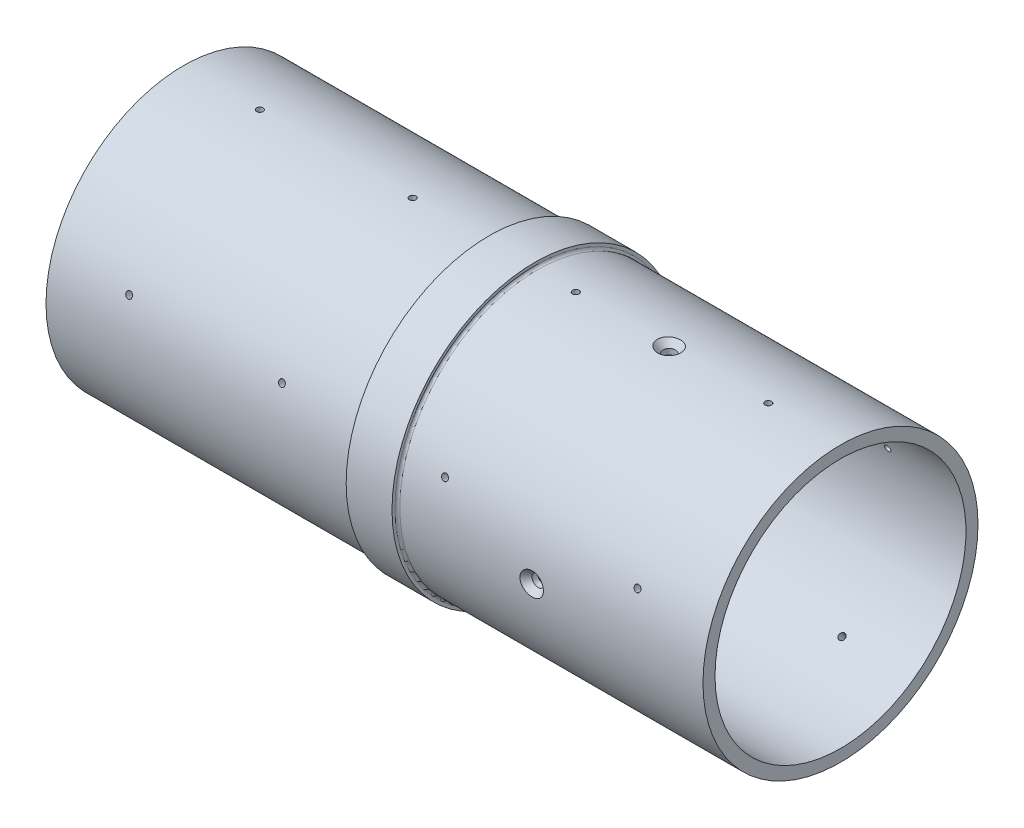
from build123d import *

# Parameters (mm, degrees)
F_6_32_TAPPED_HOLE2_REACH  = 304.768
F_6_32_TAPPED_HOLE2_BORE_R = 1.35255
F_6_32_TAPPED_HOLE1_REACH  = 304.768
F_6_32_TAPPED_HOLE1_BORE_R = 1.35255
CHAMFER1_SIZE              = 1
CIRPATTERN1_COUNT          = 4
CIRPATTERN3_COUNT          = 5


# Read off the part's stored shape, not the designer's step: CSK for #10 Flat Head Machine Screw1
with BuildPart() as part:
    # Sketch1 → Revolve1 (revolve)
    with BuildSketch(Plane(origin=(0, 0, 0), x_dir=(1, 0, 0), z_dir=(0, 1, 0)), mode=Mode.PRIVATE) as revolve1_sk:
        with BuildLine():
            Line((-95.7, 42.15), (-105.7, 52.15))
            Line((-105.7, 52.15), (-273.05, 52.15))
            Line((-273.05, 52.15), (-273.05, 57.15))
            Line((-273.05, 57.15), (-147.05, 57.15))
            ThreePointArc((-147.05, 57.15), (-146.342893219, 57.442893219), (-146.05, 58.15))
            Line((-146.05, 58.15), (-146.05, 59.4))
            Line((-146.05, 59.4), (-127, 59.4))
            Line((-127, 59.4), (-127, 58.15))
            ThreePointArc((-127, 58.15), (-126.707106781, 57.442893219), (-126, 57.15))
            Line((-126, 57.15), (0, 57.15))
            Line((0, 57.15), (0, 52.15))
            Line((0, 52.15), (-74.2, 52.15))
            Line((-74.2, 52.15), (-76.2, 52.15))
            Line((-76.2, 52.15), (-76.2, 50.15))
            Line((-76.2, 50.15), (-76.2, 42.15))
            Line((-76.2, 42.15), (-95.7, 42.15))
        make_face()
    revolve(revolve1_sk.sketch.rotate(Axis((-185.768615225, 0, 0), (1, 0, 0)), 180), axis=Axis((-185.768615225, 0, 0), (1, 0, 0)))

    # CSK for #10 Flat Head Machine Screw1 out → CSK for #10 Flat Head Machine Screw1 (revolve, cut)
    with BuildSketch(Plane(origin=(-71.2, 0, 0), x_dir=(1, 0, 0), z_dir=(0, 0, 1))):
        Polygon((4.889528756, 57.15003308), (0, 57.15003308), (0, 52.087452606), (2.5527, 52.087452606), (2.5527, 54.461819106), align=None)
    csk_for_10_flat_head_machine_screw1 = revolve(axis=Axis((-71.2, 0, 0), (0, 1, 0)), mode=Mode.SUBTRACT)

    # #6-32 Tapped Hole2 bore → #6-32 Tapped Hole2 (cut, up to next)
    with BuildSketch(Plane(origin=(0, 57.15, 0), x_dir=(1, 0, 0), z_dir=(0, 1, 0)), mode=Mode.PRIVATE) as f_6_32_tapped_hole2_sk1:
        with Locations((-30, 0)):
            Circle(F_6_32_TAPPED_HOLE2_BORE_R)
    f_6_32_tapped_hole2_tool1 = extrude(f_6_32_tapped_hole2_sk1.sketch, amount=-F_6_32_TAPPED_HOLE2_REACH, mode=Mode.PRIVATE) & part.part
    # #6-32 Tapped Hole2 bore → #6-32 Tapped Hole2 (cut, up to next)
    with BuildSketch(Plane(origin=(0, 57.15, 0), x_dir=(1, 0, 0), z_dir=(0, 1, 0)), mode=Mode.PRIVATE) as f_6_32_tapped_hole2_sk2:
        with Locations((-110, 0)):
            Circle(F_6_32_TAPPED_HOLE2_BORE_R)
    f_6_32_tapped_hole2_tool2 = extrude(f_6_32_tapped_hole2_sk2.sketch, amount=-F_6_32_TAPPED_HOLE2_REACH, mode=Mode.PRIVATE) & part.part
    f_6_32_tapped_hole2_1 = f_6_32_tapped_hole2_tool1.solids().sort_by_distance((-30, 57.15, 0))[0]
    add(f_6_32_tapped_hole2_1, mode=Mode.SUBTRACT)
    f_6_32_tapped_hole2_2 = f_6_32_tapped_hole2_tool2.solids().sort_by_distance((-110, 57.15, 0))[0]
    add(f_6_32_tapped_hole2_2, mode=Mode.SUBTRACT)
    f_6_32_tapped_hole2 = f_6_32_tapped_hole2_1 + f_6_32_tapped_hole2_2  # #6-32 Tapped Hole2 as one shape, for the pattern or mirror that repeats it

    # #6-32 Tapped Hole1 bore → #6-32 Tapped Hole1 (cut, up to next)
    with BuildSketch(Plane(origin=(0, 57.15, 0), x_dir=(1, 0, 0), z_dir=(0, 1, 0)), mode=Mode.PRIVATE) as f_6_32_tapped_hole1_sk1:
        with Locations((-241.3, 0)):
            Circle(F_6_32_TAPPED_HOLE1_BORE_R)
    f_6_32_tapped_hole1_tool1 = extrude(f_6_32_tapped_hole1_sk1.sketch, amount=-F_6_32_TAPPED_HOLE1_REACH, mode=Mode.PRIVATE) & part.part
    # #6-32 Tapped Hole1 bore → #6-32 Tapped Hole1 (cut, up to next)
    with BuildSketch(Plane(origin=(0, 57.15, 0), x_dir=(1, 0, 0), z_dir=(0, 1, 0)), mode=Mode.PRIVATE) as f_6_32_tapped_hole1_sk2:
        with Locations((-177.8, 0)):
            Circle(F_6_32_TAPPED_HOLE1_BORE_R)
    f_6_32_tapped_hole1_tool2 = extrude(f_6_32_tapped_hole1_sk2.sketch, amount=-F_6_32_TAPPED_HOLE1_REACH, mode=Mode.PRIVATE) & part.part
    f_6_32_tapped_hole1_1 = f_6_32_tapped_hole1_tool1.solids().sort_by_distance((-241.3, 57.15, 0))[0]
    add(f_6_32_tapped_hole1_1, mode=Mode.SUBTRACT)
    f_6_32_tapped_hole1_2 = f_6_32_tapped_hole1_tool2.solids().sort_by_distance((-177.8, 57.15, 0))[0]
    add(f_6_32_tapped_hole1_2, mode=Mode.SUBTRACT)
    f_6_32_tapped_hole1 = f_6_32_tapped_hole1_1 + f_6_32_tapped_hole1_2  # #6-32 Tapped Hole1 as one shape, for the pattern or mirror that repeats it

    # Chamfer1
    chamfer1_edges = [part.edges().sort_by_distance(p)[0] for p in [
        (-76.2, 0, -52.15),
    ]]
    chamfer(chamfer1_edges, length=CHAMFER1_SIZE)

    # CirPattern1: CSK for #10 Flat Head Machine Screw1 ×4 about axis
    cirpattern1_axis = Axis((0, 0, 0), (1, 0, 0))
    for i in range(1, CIRPATTERN1_COUNT):
        add(csk_for_10_flat_head_machine_screw1.rotate(cirpattern1_axis, i * 360 / CIRPATTERN1_COUNT), mode=Mode.SUBTRACT)

    # CirPattern3: #6-32 Tapped Hole2, #6-32 Tapped Hole1 ×5 about axis
    cirpattern3_axis = Axis((0, 0, 0), (1, 0, 0))
    add([f_6_32_tapped_hole2.rotate(cirpattern3_axis, i * 360 / CIRPATTERN3_COUNT) for i in range(1, CIRPATTERN3_COUNT)], mode=Mode.SUBTRACT)
    add([f_6_32_tapped_hole1.rotate(cirpattern3_axis, i * 360 / CIRPATTERN3_COUNT) for i in range(1, CIRPATTERN3_COUNT)], mode=Mode.SUBTRACT)


solid = part.part
